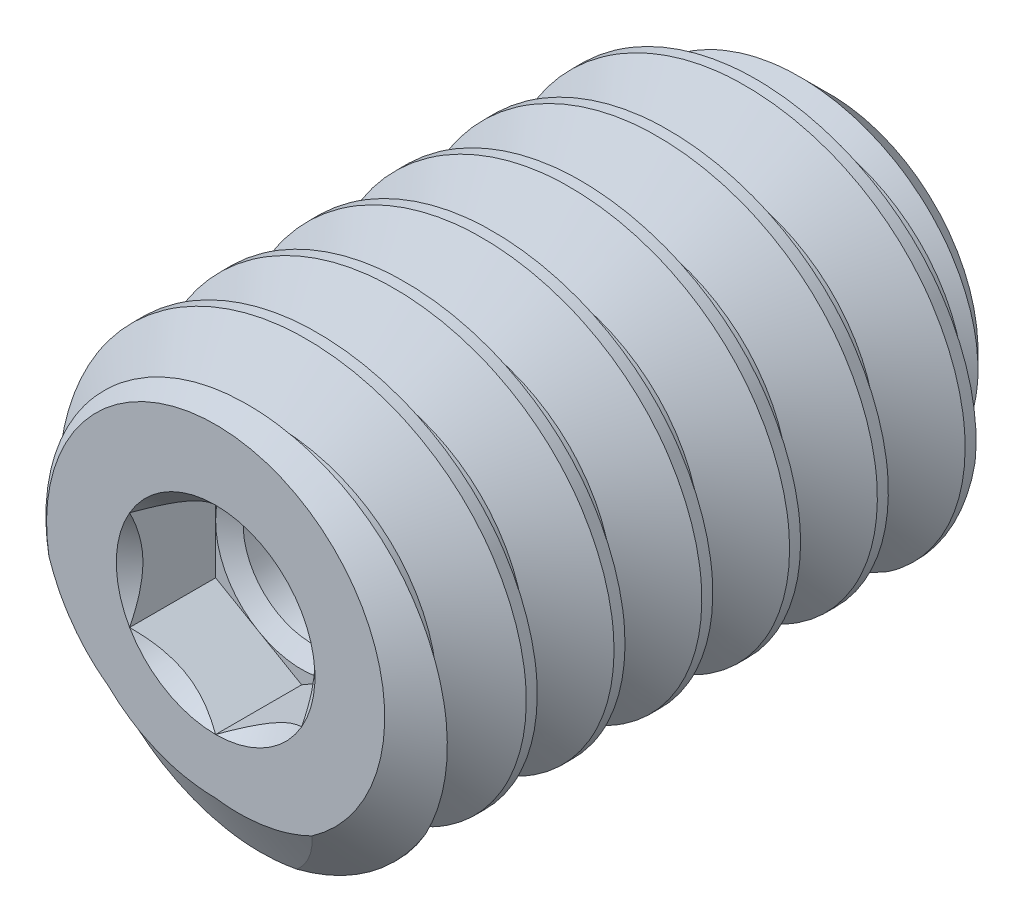
from build123d import *

# Parameters (mm, degrees)
CUT_SWEEP2_PITCH    = 0.453571429
CUT_EXTRUDE10_DEPTH = 0.4445
EXTRUDE1_DEPTH      = 3.214939883
EXTRUDE1_DEPTH_BACK = 3.214939883
SKETCH31_R          = 0.3556


with BuildPart() as part:
    # Sketch22 → Revolve1 (revolve)
    with BuildSketch(Plane(origin=(0, 0, 0), x_dir=(0, 0, -1), z_dir=(1, 0, 0)), mode=Mode.PRIVATE) as revolve1_sk:
        with BuildLine():
            Line((-1.5875, 0), (-1.5875, 0.87376))
            Line((-1.5875, 0.87376), (-1.434546665, 1.0922))
            Line((-1.434546665, 1.0922), (1.25984, 1.0922))
            Line((1.25984, 1.0922), (1.5875, 0.76454))
            Line((1.5875, 0.76454), (1.5875, 0.5461))
            ThreePointArc((1.5875, 0.5461), (1.348039528, 0.318428283), (1.25984, 0))
            Line((1.25984, 0), (-1.5875, 0))
        make_face()
    revolve(revolve1_sk.sketch.rotate(Axis((0, 0, -1.25984), (0, 0, 1)), 90), axis=Axis((0, 0, -1.25984), (0, 0, 1)))

    # Cut-Sweep2: the profile of Sketch28 profile screwed along a right-hand helix of 8 turns, 6 arcs to a turn; built about Z, then put on its axis
    cut_sweep2_z = Axis((0, 0, 0), (0, 0, 1))
    cut_sweep2_corners = [(1.0925, 0, 0.000173205), (1.0925, 0, -0.397048205), (0.797596715, 0, -0.226785714), (0.797596715, 0, -0.170089286)]
    with BuildLine(mode=Mode.PRIVATE) as cut_sweep2_profile:
        Line(cut_sweep2_corners[0], cut_sweep2_corners[1])
        Line(cut_sweep2_corners[1], cut_sweep2_corners[2])
        Line(cut_sweep2_corners[2], cut_sweep2_corners[3])
        Line(cut_sweep2_corners[3], cut_sweep2_corners[0])
    cut_sweep2_cap = Face(cut_sweep2_profile.wire())
    cut_sweep2_turn_angles = [0, 30, 60, 90, 120, 150, 180, 210, 240, 270, 300, 330, 360]
    cut_sweep2_turn_weights = [1, 0.8660254037844387, 1, 0.8660254037844387, 1, 0.8660254037844387, 1, 0.8660254037844387, 1, 0.8660254037844387, 1, 0.8660254037844387, 1]
    cut_sweep2_turn_rails = [Edge.make_bspline([Vector(p[0], p[1], 0).rotate(cut_sweep2_z, cut_sweep2_turn_angles[k]) / cut_sweep2_turn_weights[k] + Vector(0, 0, p[2] + CUT_SWEEP2_PITCH * cut_sweep2_turn_angles[k] / 360) for k in range(13)], [0, 0, 0, 1, 1, 2, 2, 3, 3, 4, 4, 5, 5, 6, 6, 6], 2, cut_sweep2_turn_weights) for p in cut_sweep2_corners]
    cut_sweep2_turn_sides = [Face.make_surface_from_curves(cut_sweep2_turn_rails[p[0]], cut_sweep2_turn_rails[p[1]]) for p in [(0, 1), (1, 2), (2, 3), (3, 0)]]
    cut_sweep2 = Plane(origin=(0, 0, -1.5875), x_dir=(0, 1, 0), z_dir=(0, 0, 1)) * Solid(Shell([*[p.moved(Location((0, 0, CUT_SWEEP2_PITCH * i))) for i in range(8) for p in cut_sweep2_turn_sides], cut_sweep2_cap, cut_sweep2_cap.rotate(cut_sweep2_z, 2880).moved(Location((0, 0, CUT_SWEEP2_PITCH * 2880 / 360)))]))
    add(cut_sweep2, mode=Mode.SUBTRACT)

    # Sketch23 → Cut-Extrude10 (cut)
    with BuildSketch(Plane.XY.offset(1.5875)):
        Polygon((0, 0.513264389), (-0.4445, 0.256632195), (-0.4445, -0.256632195), (0, -0.513264389), (0.4445, -0.256632195), (0.4445, 0.256632195), align=None)
    extrude(amount=-CUT_EXTRUDE10_DEPTH, mode=Mode.SUBTRACT)

    # Cut-Extrude11 cone 1 section (through the dimple's axis) → Cut-Extrude11 (revolve, cut)
    with BuildSketch(Plane(origin=(0, 0, 1.5875), x_dir=(0, -1, 0), z_dir=(1, 0, 0))):
        Polygon((0, 0), (0.513264389, 0), (0, 0.513264389), align=None)
    revolve(axis=Axis((0, 0, 1.5875), (0, 0, -1)), mode=Mode.SUBTRACT)

    # Cut-Extrude12 cone 1 section (through the dimple's axis) → Cut-Extrude12 (revolve, cut)
    with BuildSketch(Plane(origin=(0, 0, 1.143), x_dir=(0, -1, 0), z_dir=(1, 0, 0))):
        Polygon((0, 0), (0.4445, 0), (0, 0.267082545), align=None)
    revolve(axis=Axis((0, 0, 1.143), (0, 0, -1)), mode=Mode.SUBTRACT)

    # Sketch31 → Extrude1 (cut, two sides: drawn at the far end of the back side and taken through both)
    with BuildSketch(Plane.XY.offset(-EXTRUDE1_DEPTH_BACK)):
        Circle(SKETCH31_R)
    extrude(amount=EXTRUDE1_DEPTH + EXTRUDE1_DEPTH_BACK, mode=Mode.SUBTRACT)


solid = part.part
